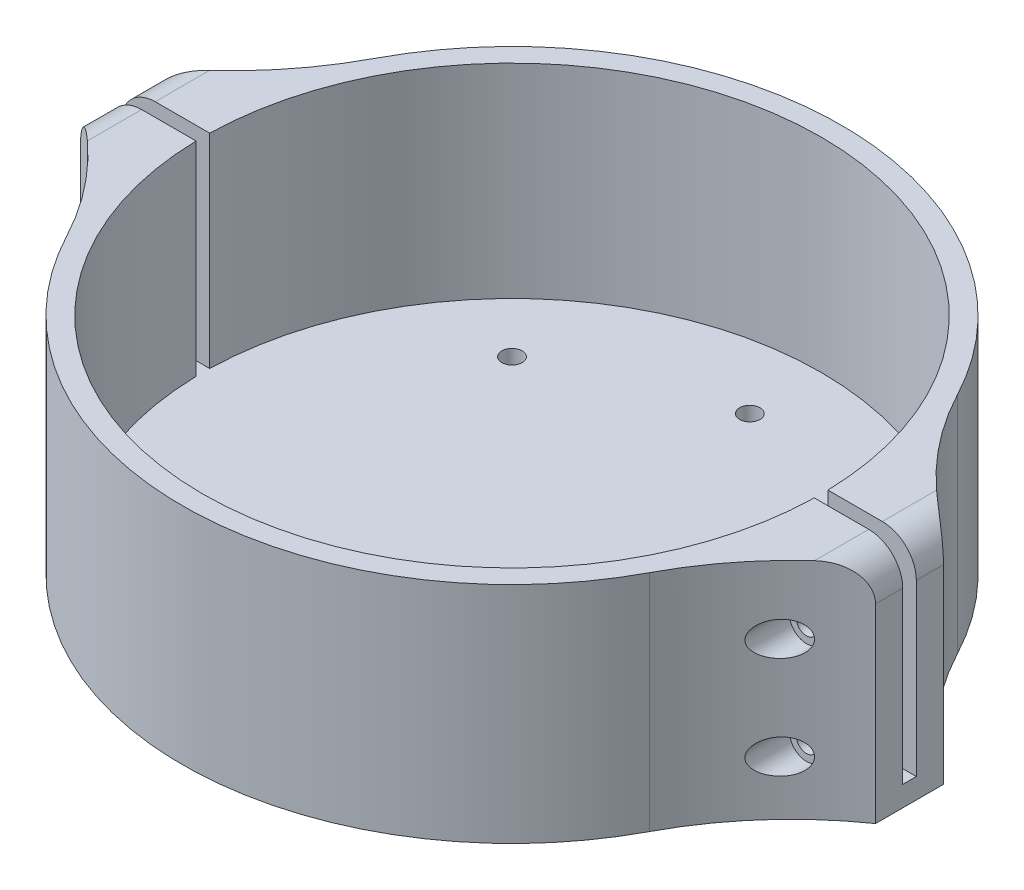
from build123d import *
from build123d.topology import SkipClean

# Parameters (mm, degrees)
SKETCH1_R           = 48.5
SKETCH1_R_2         = 45.5
BOSS_EXTRUDE1_DEPTH = 30
BOSS_EXTRUDE2_START = 3
SKETCH2_R           = 48.5
BOSS_EXTRUDE2_DEPTH = 3
SKETCH3_R           = 1.5
CUT_EXTRUDE2_DEPTH  = 3
SKETCH6_W           = 117
SKETCH6_H           = 33
BOSS_EXTRUDE4_DEPTH = 5
CUT_EXTRUDE3_DEPTH  = 30
FILLET1_R           = 50
FILLET3_R           = 5
SKETCH8_R           = 1.5
CUT_EXTRUDE4_DEPTH  = 25
SKETCH9_R           = 2.5
CUT_EXTRUDE5_DEPTH  = 15
CUT_EXTRUDE6_START  = -15
SKETCH10_R          = 2.5
CUT_EXTRUDE6_DEPTH  = 15


with BuildPart() as part:
    # Sketch1 → Boss-Extrude1 (new body)
    with BuildSketch(Plane(origin=(0, 0, 0), x_dir=(1, 0, 0), z_dir=(0, 1, 0))):
        with Locations(Location((0, 0, 0), (0, 0, 270))):
            Circle(SKETCH1_R)
        with Locations(Location((0, 0, 0), (0, 0, 270))):
            Circle(SKETCH1_R_2, mode=Mode.SUBTRACT)
    extrude(amount=BOSS_EXTRUDE1_DEPTH)

    # Sketch2 → Boss-Extrude2 (add)
    with BuildSketch(Plane.XZ.offset(BOSS_EXTRUDE2_START)):
        with Locations(Location((0, 0, 0), (0, 0, 270))):
            Circle(SKETCH2_R)
    extrude(amount=-BOSS_EXTRUDE2_DEPTH)

    # Sketch3 → Cut-Extrude2 (cut)
    with BuildSketch(Plane(origin=(0, -3, 0), x_dir=(-1, 0, 0), z_dir=(0, -1, 0))):
        with Locations(Location((0, -35, 0), (0, 0, 90))):
            Circle(SKETCH3_R)
        with Locations(Location((-24.748737342, -24.748737342, 0), (0, 0, 90))):
            Circle(SKETCH3_R)
        with Locations(Location((-35, 0, 0), (0, 0, 90))):
            Circle(SKETCH3_R)
        with Locations(Location((-24.748737342, 24.748737342, 0), (0, 0, 90))):
            Circle(SKETCH3_R)
        with Locations(Location((0, 35, 0), (0, 0, 90))):
            Circle(SKETCH3_R)
        with Locations(Location((24.748737342, 24.748737342, 0), (0, 0, 90))):
            Circle(SKETCH3_R)
        with Locations(Location((35, 0, 0), (0, 0, 90))):
            Circle(SKETCH3_R)
        with Locations(Location((24.748737342, -24.748737342, 0), (0, 0, 90))):
            Circle(SKETCH3_R)
    extrude(amount=-CUT_EXTRUDE2_DEPTH, mode=Mode.SUBTRACT)

    # Sketch6 → Boss-Extrude4 (add, symmetric)
    with BuildSketch(Plane.XY):
        with Locations((0, 13.5)):
            Rectangle(SKETCH6_W, SKETCH6_H)
    extrude(amount=BOSS_EXTRUDE4_DEPTH, both=True)

    # Sketch7 → Cut-Extrude3 (cut, symmetric)
    with SkipClean():  # the faces are left unmerged after this step: merging them gives an invalid solid
        with BuildSketch(Plane(origin=(0, 30, 0), x_dir=(1, 0, 0), z_dir=(0, 1, 0))):
            with BuildLine():
                Line((-58.5, 1), (-45.489009662, 1))
                ThreePointArc((-45.489009662, 1), (0, 45.5), (45.489009662, 1))
                Line((45.489009662, 1), (58.5, 1))
                Line((58.5, 1), (58.5, -1))
                Line((58.5, -1), (45.489009662, -1))
                ThreePointArc((45.489009662, -1), (0, -45.5), (-45.489009662, -1))
                Line((-45.489009662, -1), (-58.5, -1))
                Line((-58.5, -1), (-58.5, 1))
            make_face()
        extrude(amount=CUT_EXTRUDE3_DEPTH, both=True, mode=Mode.SUBTRACT)

    # Fillet1
    # the kernel refuses this fillet: 50 mm, written as the material it adds along each edge
    with BuildSketch(Plane(origin=(48.241579576, -3, -5), x_dir=(1, 0, 0), z_dir=(0, 1, 0))) as fillet1_piece_1:
        with BuildLine():
            CenterArc((38.846361668, 41.021087448), FILLET1_R, 207.853937199, 27.273097551)
            Line((-5.360715106, 17.660129353), (-6.244856641, 17.192910191))
            ThreePointArc((-6.244856641, 17.192910191), (-2.789469198, 8.796943943), (-0.994671744, -0.103092784))
            Line((-0.994671744, -0.103092784), (0, -1))
            ThreePointArc((0, -1), (5.129210212, -1), (9.686661599, -0.820421749))
            Line((9.686661599, -0.820421749), (10.258420424, 0))
        make_face()
    extrude(amount=33)
    with BuildSketch(Plane(origin=(-48.241579576, 30, -5), x_dir=(0.29046197773875826, -1.7108015740210894e-14, -0.956886534280888), z_dir=(0, -1, 0))) as fillet1_piece_2:
        with BuildLine():
            CenterArc((27.969135163, -49.086626575), FILLET1_R, 100.968321224, 27.273097551)
            Line((-2.979681085, -9.816144367), (-3.59865741, -9.030734722))
            ThreePointArc((-3.59865741, -9.030734722), (-2.446727077, -4.617610206), (-0.956886534, 0.290461978))
            Line((-0.956886534, 0.290461978), (0.190266226, 0.981732531))
            ThreePointArc((0.190266226, 0.981732531), (9.227911942, 0.114027778), (18.265557657, 0.981732531))
            Line((18.265557657, 0.981732531), (18.455823883, 0))
        make_face()
    extrude(amount=33)
    with BuildSketch(Plane(origin=(48.241579576, -3, 5), x_dir=(-0.2904619777387585, 1.5489194551809934e-14, 0.9568865342808879), z_dir=(0, 1, 0)), Plane(origin=(-48.241579576, 30, 5), x_dir=(0.2904619777387555, 1.6982933529121933e-14, 0.956886534280889), z_dir=(0, -1, 0))) as fillet1_piece_3:
        with BuildLine():
            CenterArc((27.969135163, 49.086626575), FILLET1_R, 231.758581225, 27.273097551)
            Line((-2.979681085, 9.816144367), (-3.59865741, 9.030734722))
            ThreePointArc((-3.59865741, 9.030734722), (-2.446727077, 4.617610206), (-0.956886534, -0.290461978))
            Line((-0.956886534, -0.290461978), (0.190266226, -0.981732531))
            ThreePointArc((0.190266226, -0.981732531), (9.227911942, -0.114027778), (18.265557657, -0.981732531))
            Line((18.265557657, -0.981732531), (18.455823883, 0))
        make_face()
    extrude(amount=33)

    # Fillet3
    # the kernel refuses this fillet: 5 mm, written as the material it takes off along each edge
    with BuildSketch(Plane(origin=(58.5, 30, 17.5), x_dir=(-1, 0, 0), z_dir=(0, 0, -1)), Plane(origin=(58.5, 30, 11.5), x_dir=(-1, 0, 0), z_dir=(0, 0, -1))) as fillet3_piece_1:
        with BuildLine():
            CenterArc((FILLET3_R, -FILLET3_R), FILLET3_R, 90, 90)
            Line((0, -FILLET3_R), (0, 0))
            Line((0, 0), (FILLET3_R, 0))
        make_face()
    extrude(amount=29, mode=Mode.SUBTRACT)
    with BuildSketch(Plane(origin=(-58.5, 30, -11.5), x_dir=(0, -1, 0), z_dir=(0, 0, 1)), Plane(origin=(-58.5, 30, -17.5), x_dir=(0, -1, 0), z_dir=(0, 0, 1))) as fillet3_piece_2:
        with BuildLine():
            CenterArc((FILLET3_R, FILLET3_R), FILLET3_R, 180, 90)
            Line((0, FILLET3_R), (0, 0))
            Line((0, 0), (FILLET3_R, 0))
        make_face()
    extrude(amount=29, mode=Mode.SUBTRACT)

    # Sketch8 → Cut-Extrude4 (cut, symmetric)
    with SkipClean():  # the faces are left unmerged after this step: merging them gives an invalid solid
        with BuildSketch(Plane.XY):
            with Locations(Location((-51, 20, 0), (0, 0, 180))):
                Circle(SKETCH8_R)
            with Locations(Location((-51, 5, 0), (0, 0, 180))):
                Circle(SKETCH8_R)
        cut_extrude4 = extrude(amount=CUT_EXTRUDE4_DEPTH, both=True, mode=Mode.SUBTRACT)

    # Mirror1: Cut-Extrude4 across plane
    with SkipClean():  # the faces are left unmerged after this step: merging them gives an invalid solid
        add(cut_extrude4.mirror(Plane(origin=(0, 0, 0), x_dir=(0, 0, 1), z_dir=(1, 0, 0))), mode=Mode.SUBTRACT)

    # Sketch9 → Cut-Extrude5 (cut)
    with SkipClean():  # the faces are left unmerged after this step: merging them gives an invalid solid
        with BuildSketch(Plane.XY.offset(22.660129353)):
            with Locations((-51, 20)):
                Circle(SKETCH9_R)
            with Locations((-51, 5)):
                Circle(SKETCH9_R)
        cut_extrude5 = extrude(amount=-CUT_EXTRUDE5_DEPTH, mode=Mode.SUBTRACT)

    # Mirror2: Cut-Extrude5 across plane
    with SkipClean():  # the faces are left unmerged after this step: merging them gives an invalid solid
        add(cut_extrude5.mirror(Plane(origin=(0, 0, 0), x_dir=(0, 0, 1), z_dir=(1, 0, 0))), mode=Mode.SUBTRACT)

    # Sketch10 → Cut-Extrude6 (cut)
    with SkipClean():  # the faces are left unmerged after this step: merging them gives an invalid solid
        with BuildSketch(Plane(origin=(0, 0, -22.660129353), x_dir=(-1, 0, 0), z_dir=(0, 0, -1)).offset(CUT_EXTRUDE6_START)):
            with Locations(Location((-51, 20, 0), (0, 0, 180))):
                Circle(SKETCH10_R)
            with Locations(Location((-51, 5, 0), (0, 0, 180))):
                Circle(SKETCH10_R)
        cut_extrude6 = extrude(amount=CUT_EXTRUDE6_DEPTH, mode=Mode.SUBTRACT)

    # Mirror3: Cut-Extrude6 across plane
    with SkipClean():  # the faces are left unmerged after this step: merging them gives an invalid solid
        add(cut_extrude6.mirror(Plane(origin=(0, 0, 0), x_dir=(0, 0, 1), z_dir=(1, 0, 0))), mode=Mode.SUBTRACT)


solid = part.part
